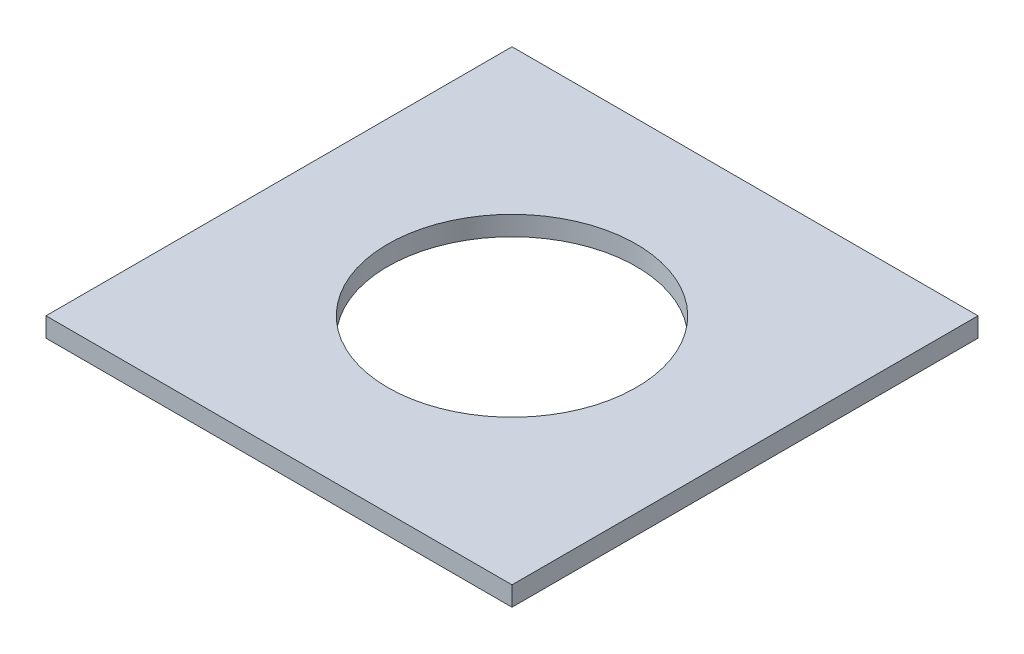
from build123d import *

# Parameters (mm, degrees)
SKETCH1_W           = 304.8
SKETCH1_H           = 304.8
BOSS_EXTRUDE1_DEPTH = 12.7
SKETCH5_R           = 81.2764
CUT_EXTRUDE4_DEPTH  = 216.9


with BuildPart() as part:
    # Sketch1 → Boss-Extrude1 (new body)
    with BuildSketch(Plane(origin=(0, 0, 0), x_dir=(1, 0, 0), z_dir=(0, 1, 0))):
        Rectangle(SKETCH1_W, SKETCH1_H)
    extrude(amount=BOSS_EXTRUDE1_DEPTH)

    # Sketch5 → Cut-Extrude4 (cut, through all)
    with BuildSketch(Plane(origin=(0, 12.7, 0), x_dir=(1, 0, 0), z_dir=(0, 1, 0))):
        Circle(SKETCH5_R)
    extrude(amount=-CUT_EXTRUDE4_DEPTH, mode=Mode.SUBTRACT)


solid = part.part
